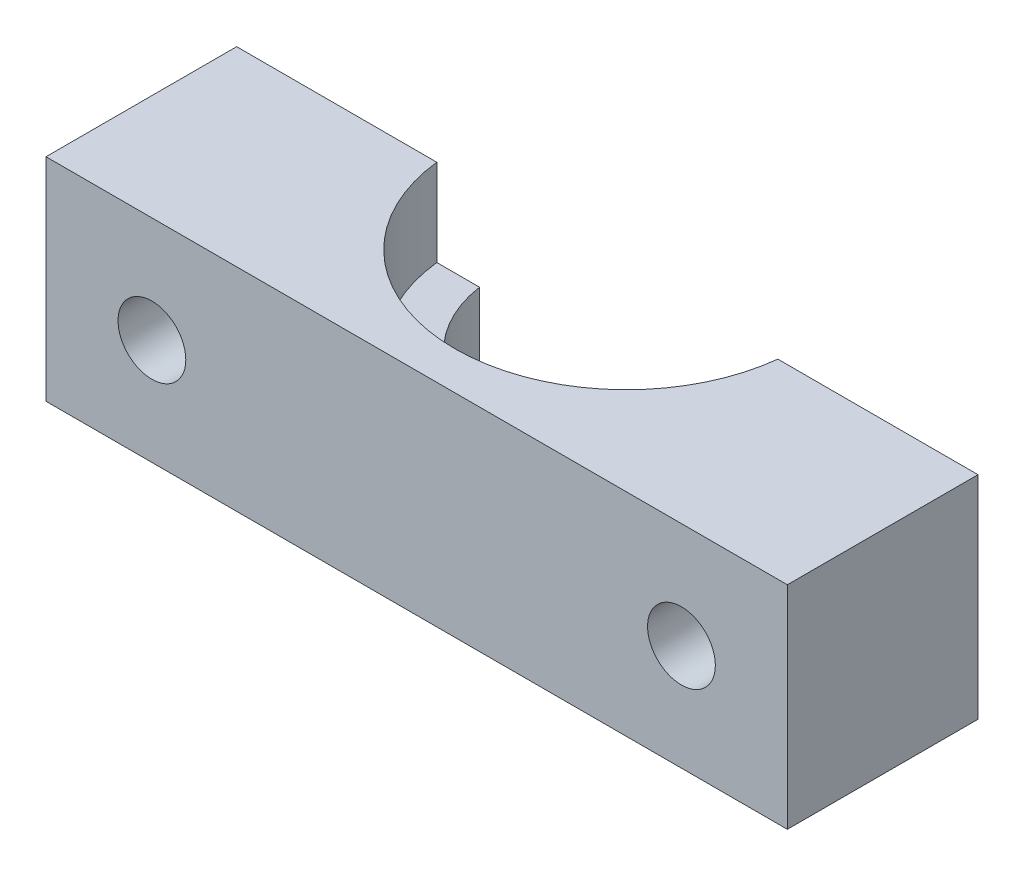
from build123d import *

# Parameters (mm, degrees)
SKETCH1_W           = 35
SKETCH1_H           = 27
SKETCH1_R           = 1.5
BOSS_EXTRUDE1_DEPTH = 25
SKETCH3_W           = 20
SKETCH3_H           = 10
SKETCH3_H_2         = 7
CUT_EXTRUDE1_DEPTH  = 51.783855702
SKETCH4_R           = 6.1
CUT_EXTRUDE6_DEPTH  = 47.249324319
SKETCH5_R           = 8.1
CUT_EXTRUDE7_DEPTH  = 4.1
SKETCH7_R           = 1.6
CUT_EXTRUDE8_DEPTH  = 51.783855702
CUT_EXTRUDE9_DEPTH  = 10
SKETCH10_W          = 35
SKETCH10_H          = 27
CUT_EXTRUDE10_DEPTH = 16


with BuildPart() as part:
    # Sketch1 → Boss-Extrude1 (new body)
    with BuildSketch(Plane.XY):
        with Locations((17.5, -13.5)):
            Rectangle(SKETCH1_W, SKETCH1_H)
        with Locations((10, -3.5)):
            Circle(SKETCH1_R, mode=Mode.SUBTRACT)
        with Locations((25, -3.5)):
            Circle(SKETCH1_R, mode=Mode.SUBTRACT)
        with Locations((10, -23.5)):
            Circle(SKETCH1_R, mode=Mode.SUBTRACT)
        with Locations((25, -23.5)):
            Circle(SKETCH1_R, mode=Mode.SUBTRACT)
    extrude(amount=BOSS_EXTRUDE1_DEPTH)

    # Sketch3 → Cut-Extrude1 (cut, through all)
    with BuildSketch(Plane.ZY):
        with Locations((15, -5)):
            Rectangle(SKETCH3_W, SKETCH3_H)
        with Locations((15, -23.5)):
            Rectangle(SKETCH3_W, SKETCH3_H_2)
    extrude(amount=-CUT_EXTRUDE1_DEPTH, mode=Mode.SUBTRACT)

    # Sketch4 → Cut-Extrude6 (cut, through all)
    with BuildSketch(Plane(origin=(0, -10, 0), x_dir=(1, 0, 0), z_dir=(0, 1, 0))):
        with Locations((17.499714283, -15.1)):
            Circle(SKETCH4_R)
    extrude(amount=-CUT_EXTRUDE6_DEPTH, mode=Mode.SUBTRACT)

    # Sketch5 → Cut-Extrude7 (cut)
    with BuildSketch(Plane(origin=(0, -10, 0), x_dir=(1, 0, 0), z_dir=(0, 1, 0))):
        with Locations((17.499714283, -15.1)):
            Circle(SKETCH5_R)
    extrude(amount=-CUT_EXTRUDE7_DEPTH, mode=Mode.SUBTRACT)

    # Sketch7 → Cut-Extrude8 (cut, through all)
    with BuildSketch(Plane.XY.offset(25)):
        with Locations((5, -15)):
            Circle(SKETCH7_R)
        with Locations((30, -15)):
            Circle(SKETCH7_R)
    extrude(amount=-CUT_EXTRUDE8_DEPTH, mode=Mode.SUBTRACT)

    # Sketch9 → Cut-Extrude9 (cut)
    with BuildSketch(Plane(origin=(0, 0, 0), x_dir=(-1, 0, 0), z_dir=(0, 0, -1))):
        Polygon((-30, -11.95), (-32.641377482, -13.475), (-32.641377482, -16.525), (-30, -18.05), (-27.358622518, -16.525), (-27.358622518, -13.475), align=None)
        Polygon((-5, -11.95), (-7.641377482, -13.475), (-7.641377482, -16.525), (-5, -18.05), (-2.358622518, -16.525), (-2.358622518, -13.475), align=None)
    extrude(amount=-CUT_EXTRUDE9_DEPTH, mode=Mode.SUBTRACT)

    # Sketch10 → Cut-Extrude10 (cut)
    with BuildSketch(Plane(origin=(0, 0, 0), x_dir=(-1, 0, 0), z_dir=(0, 0, -1))):
        with Locations((-17.5, -13.5)):
            Rectangle(SKETCH10_W, SKETCH10_H)
    extrude(amount=-CUT_EXTRUDE10_DEPTH, mode=Mode.SUBTRACT)


solid = part.part
